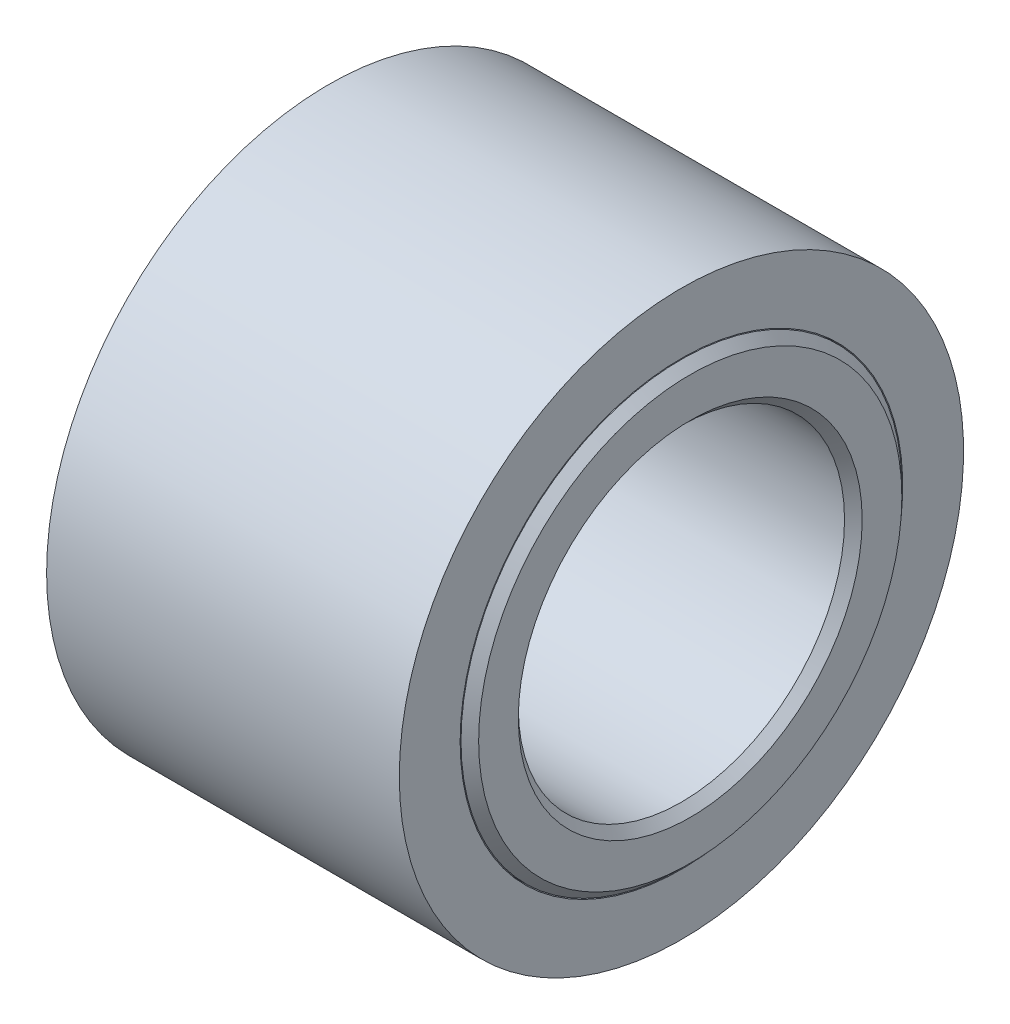
from build123d import *

# Parameters (mm, degrees)
CORTE_EXTRUS_O1_REACH         = 29.45
ESBO_O3_R                     = 1.5
FURO_ROSCADO_DE_M41_OUTLINE_R = 1.65
FURO_ROSCADO_DE_M41_DEPTH     = 11.000000058
CHANFRO1_SIZE                 = 0.5


# Read off the part's stored shape, not the designer's step: Furo roscado de M41
with BuildPart() as part:
    # Esboço2 → Revolução1 (revolve)
    with BuildSketch(Plane.XY, mode=Mode.PRIVATE) as revolu_o1_sk:
        Polygon((0, 0), (0, 12.5), (1.5, 12.5), (1.5, 11), (19.5, 11), (19.5, 12.5), (21, 12.5), (21, 9.25), (7, 9.25), (7, 0), align=None)
    revolve(revolu_o1_sk.sketch.rotate(Axis((0, 0, 0), (1, 0, 0)), 90), axis=Axis((0, 0, 0), (1, 0, 0)))

    # Esboço3 → Corte-extrusão1 (cut, up to next)
    with BuildSketch(Plane.ZY, mode=Mode.PRIVATE) as corte_extrus_o1_sk1:
        Circle(ESBO_O3_R)
    corte_extrus_o1_tool1 = extrude(corte_extrus_o1_sk1.sketch, amount=-CORTE_EXTRUS_O1_REACH, mode=Mode.PRIVATE) & part.part
    add(corte_extrus_o1_tool1.solids().sort_by_distance((0, 0, 0))[0], mode=Mode.SUBTRACT)

    # Furo roscado de M41 outline → Furo roscado de M41 (cut)
    with BuildSketch(Plane(origin=(0, 0, 0), x_dir=(1, 0, 0), z_dir=(0, 1, 0))):
        with Locations((4, 0)):
            Circle(FURO_ROSCADO_DE_M41_OUTLINE_R)
    extrude(amount=FURO_ROSCADO_DE_M41_DEPTH, mode=Mode.SUBTRACT)

    # Chanfro1
    chanfro1_edges = [part.edges().sort_by_distance(p)[0] for p in [
        (0, 0, -12.5),
        (21, 0, -9.25),
        (21, 0, -12.5),
    ]]
    chamfer(chanfro1_edges, length=CHANFRO1_SIZE)


with BuildPart() as body_2:
    # Esboço6 → Revolução2 (revolve)
    with BuildSketch(Plane.XY, mode=Mode.PRIVATE) as revolu_o2_sk:
        Polygon((1.55, 11.1), (1.55, 12.55), (0.5, 12.55), (0.5, 16), (20.5, 16), (20.5, 12.55), (19.45, 12.55), (19.45, 11.1), align=None)
    revolve(revolu_o2_sk.sketch.rotate(Axis((0, 0, 0), (1, 0, 0)), 90), axis=Axis((0, 0, 0), (1, 0, 0)))


solid = Compound([part.part, body_2.part])
